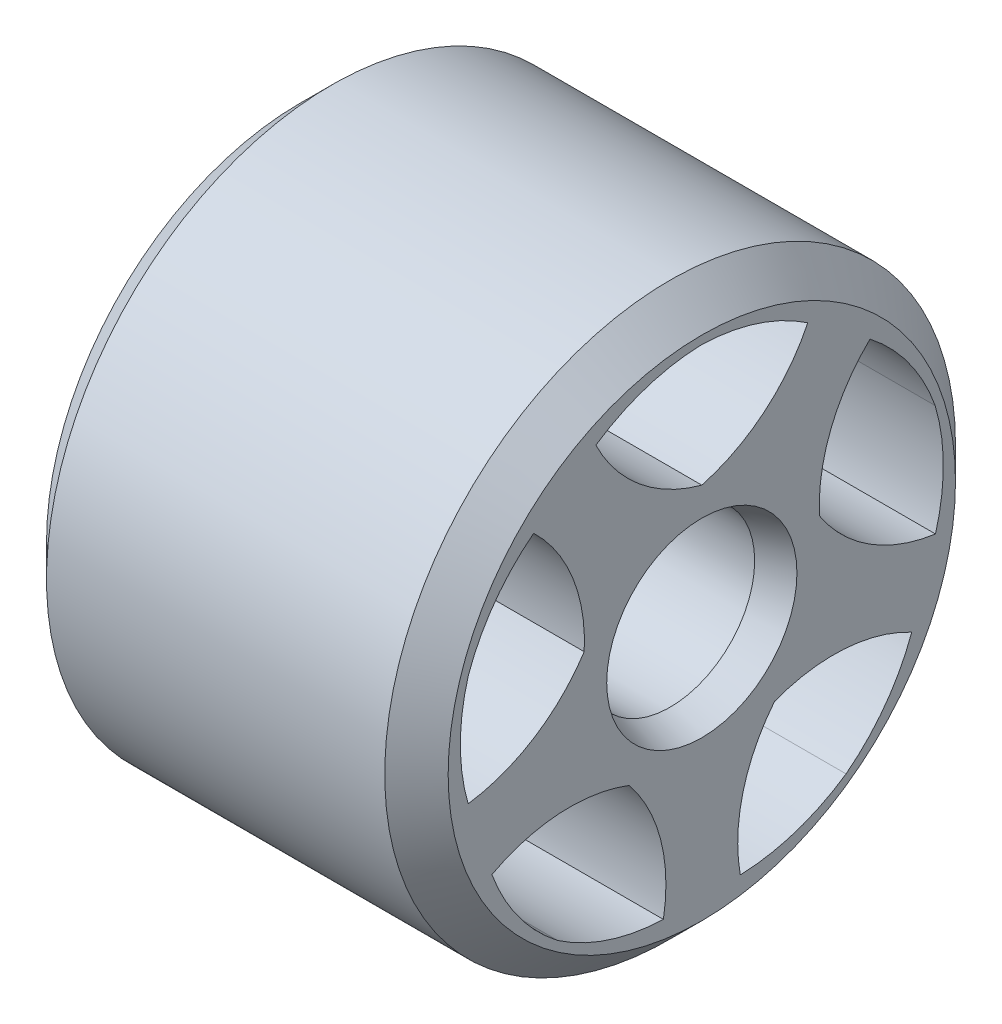
from build123d import *

# Parameters (mm, degrees)
SKETCH1_R           = 13.5
SKETCH1_R_2         = 4
BOSS_EXTRUDE1_DEPTH = 9.5
CUT_EXTRUDE1_DEPTH  = 22.324868112
CIRPATTERN1_COUNT   = 5
CHAMFER1_SIZE       = 1.5
CHAMFER2_SIZE       = 0.5
CHAMFER2_SIZE2      = 1.5


with BuildPart() as part:
    # Sketch1 → Boss-Extrude1 (new, symmetric)
    with BuildSketch(Plane(origin=(0, 0, 0), x_dir=(0, 0, -1), z_dir=(1, 0, 0))):
        Circle(SKETCH1_R)
        Circle(SKETCH1_R_2, mode=Mode.SUBTRACT)
    extrude(amount=BOSS_EXTRUDE1_DEPTH, both=True)

    # Sketch2 → Cut-Extrude1 (cut, symmetric)
    with BuildSketch(Plane(origin=(0, 0, 0), x_dir=(0, 0, -1), z_dir=(1, 0, 0))):
        with BuildLine():
            ThreePointArc((0, 5.849695328), (-2.956289657, 7.377375059), (-5.012219469, 9.99397715))
            ThreePointArc((-5.012219469, 9.99397715), (-2.621563936, 11.159720287), (0, 11.6087119))
            ThreePointArc((0, 11.6087119), (2.621563936, 11.159720287), (5.012219469, 9.99397715))
            ThreePointArc((5.012219469, 9.99397715), (2.956289657, 7.377375059), (0, 5.849695328))
        make_face()
    cut_extrude1 = extrude(amount=CUT_EXTRUDE1_DEPTH, both=True, mode=Mode.SUBTRACT)

    # CirPattern1: Cut-Extrude1 ×5 about axis
    cirpattern1_axis = Axis((9.5, 0, 0), (-1, 0, 0))
    for i in range(1, CIRPATTERN1_COUNT):
        add(cut_extrude1.rotate(cirpattern1_axis, i * 360 / CIRPATTERN1_COUNT), mode=Mode.SUBTRACT)

    # Chamfer1
    chamfer1_edges = [part.edges().sort_by_distance(p)[0] for p in [
        (9.5, 0, 13.5),
        (-9.5, 0, 13.5),
    ]]
    chamfer(chamfer1_edges, length=CHAMFER1_SIZE)

    # Chamfer2
    chamfer2_edges = [part.edges().sort_by_distance(p)[0] for p in [
        (9.5, 0, 4),
    ]]
    chamfer2_side = [part.faces().sort_by_distance(p)[0] for p in [
        (9.5, 0, 11.660588745),
    ]]
    chamfer(chamfer2_edges, length=CHAMFER2_SIZE, length2=CHAMFER2_SIZE2, reference=chamfer2_side[0])


solid = part.part
